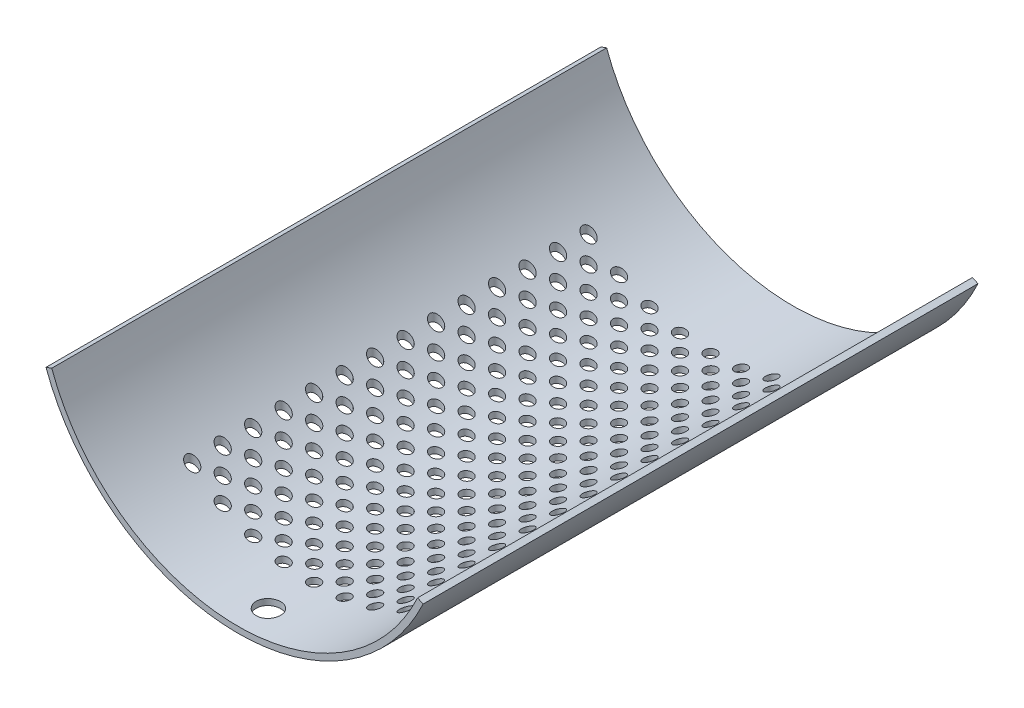
from build123d import *

# Parameters (mm, degrees)
BOSS_EXTRUDE1_DEPTH      = 170
BOSS_EXTRUDE1_DEPTH_BACK = 12
SKETCH2_R                = 2
SKETCH2_R_2              = 4
CUT_EXTRUDE1_DEPTH       = 90


with BuildPart() as part:
    # Sketch1 → Boss-Extrude1 (new, two sides: drawn at the far end of the back side and taken through both)
    with BuildSketch(Plane.XY.offset(-BOSS_EXTRUDE1_DEPTH_BACK)):
        with BuildLine():
            Line((-61.080020351, -22.231309316), (-62.959405593, -22.915349603))
            ThreePointArc((-62.959405593, -22.915349603), (-2.922498953, -66.936230846), (60.722621731, -28.315423537))
            Line((60.722621731, -28.315423537), (58.910006157, -27.470187013))
            ThreePointArc((58.910006157, -27.470187013), (-2.835260179, -64.938134403), (-61.080020351, -22.231309316))
        make_face()
    extrude(amount=BOSS_EXTRUDE1_DEPTH + BOSS_EXTRUDE1_DEPTH_BACK)

    # Sketch2 → Cut-Extrude1 (cut)
    with BuildSketch(Plane(origin=(0, 0, 0), x_dir=(1, 0, 0), z_dir=(0, 1, 0))):
        with Locations(Location((0, -145, 0), (0, 0, 270))):
            Circle(SKETCH2_R)
        with Locations(Location((10, -145, 0), (0, 0, 270))):
            Circle(SKETCH2_R)
        with Locations(Location((20, -145, 0), (0, 0, 270))):
            Circle(SKETCH2_R)
        with Locations(Location((30, -145, 0), (0, 0, 270))):
            Circle(SKETCH2_R)
        with Locations(Location((40, -145, 0), (0, 0, 270))):
            Circle(SKETCH2_R)
        with Locations(Location((10, -135, 0), (0, 0, 270))):
            Circle(SKETCH2_R)
        with Locations(Location((20, -135, 0), (0, 0, 270))):
            Circle(SKETCH2_R)
        with Locations(Location((30, -135, 0), (0, 0, 270))):
            Circle(SKETCH2_R)
        with Locations(Location((40, -135, 0), (0, 0, 270))):
            Circle(SKETCH2_R)
        with Locations(Location((10, -125, 0), (0, 0, 270))):
            Circle(SKETCH2_R)
        with Locations(Location((20, -125, 0), (0, 0, 270))):
            Circle(SKETCH2_R)
        with Locations(Location((30, -125, 0), (0, 0, 270))):
            Circle(SKETCH2_R)
        with Locations(Location((40, -125, 0), (0, 0, 270))):
            Circle(SKETCH2_R)
        with Locations(Location((10, -115, 0), (0, 0, 270))):
            Circle(SKETCH2_R)
        with Locations(Location((20, -115, 0), (0, 0, 270))):
            Circle(SKETCH2_R)
        with Locations(Location((30, -115, 0), (0, 0, 270))):
            Circle(SKETCH2_R)
        with Locations(Location((40, -115, 0), (0, 0, 270))):
            Circle(SKETCH2_R)
        with Locations(Location((10, -105, 0), (0, 0, 270))):
            Circle(SKETCH2_R)
        with Locations(Location((20, -105, 0), (0, 0, 270))):
            Circle(SKETCH2_R)
        with Locations(Location((30, -105, 0), (0, 0, 270))):
            Circle(SKETCH2_R)
        with Locations(Location((40, -105, 0), (0, 0, 270))):
            Circle(SKETCH2_R)
        with Locations(Location((10, -95, 0), (0, 0, 270))):
            Circle(SKETCH2_R)
        with Locations(Location((20, -95, 0), (0, 0, 270))):
            Circle(SKETCH2_R)
        with Locations(Location((30, -95, 0), (0, 0, 270))):
            Circle(SKETCH2_R)
        with Locations(Location((40, -95, 0), (0, 0, 270))):
            Circle(SKETCH2_R)
        with Locations(Location((10, -85, 0), (0, 0, 270))):
            Circle(SKETCH2_R)
        with Locations(Location((20, -85, 0), (0, 0, 270))):
            Circle(SKETCH2_R)
        with Locations(Location((30, -85, 0), (0, 0, 270))):
            Circle(SKETCH2_R)
        with Locations(Location((40, -85, 0), (0, 0, 270))):
            Circle(SKETCH2_R)
        with Locations(Location((10, -75, 0), (0, 0, 270))):
            Circle(SKETCH2_R)
        with Locations(Location((20, -75, 0), (0, 0, 270))):
            Circle(SKETCH2_R)
        with Locations(Location((30, -75, 0), (0, 0, 270))):
            Circle(SKETCH2_R)
        with Locations(Location((40, -75, 0), (0, 0, 270))):
            Circle(SKETCH2_R)
        with Locations(Location((10, -65, 0), (0, 0, 270))):
            Circle(SKETCH2_R)
        with Locations(Location((20, -65, 0), (0, 0, 270))):
            Circle(SKETCH2_R)
        with Locations(Location((30, -65, 0), (0, 0, 270))):
            Circle(SKETCH2_R)
        with Locations(Location((40, -65, 0), (0, 0, 270))):
            Circle(SKETCH2_R)
        with Locations(Location((10, -55, 0), (0, 0, 270))):
            Circle(SKETCH2_R)
        with Locations(Location((20, -55, 0), (0, 0, 270))):
            Circle(SKETCH2_R)
        with Locations(Location((30, -55, 0), (0, 0, 270))):
            Circle(SKETCH2_R)
        with Locations(Location((40, -55, 0), (0, 0, 270))):
            Circle(SKETCH2_R)
        with Locations(Location((10, -45, 0), (0, 0, 270))):
            Circle(SKETCH2_R)
        with Locations(Location((20, -45, 0), (0, 0, 270))):
            Circle(SKETCH2_R)
        with Locations(Location((30, -45, 0), (0, 0, 270))):
            Circle(SKETCH2_R)
        with Locations(Location((40, -45, 0), (0, 0, 270))):
            Circle(SKETCH2_R)
        with Locations(Location((10, -35, 0), (0, 0, 270))):
            Circle(SKETCH2_R)
        with Locations(Location((20, -35, 0), (0, 0, 270))):
            Circle(SKETCH2_R)
        with Locations(Location((30, -35, 0), (0, 0, 270))):
            Circle(SKETCH2_R)
        with Locations(Location((40, -35, 0), (0, 0, 270))):
            Circle(SKETCH2_R)
        with Locations(Location((10, -25, 0), (0, 0, 270))):
            Circle(SKETCH2_R)
        with Locations(Location((20, -25, 0), (0, 0, 270))):
            Circle(SKETCH2_R)
        with Locations(Location((30, -25, 0), (0, 0, 270))):
            Circle(SKETCH2_R)
        with Locations(Location((40, -25, 0), (0, 0, 270))):
            Circle(SKETCH2_R)
        with Locations(Location((10, -15, 0), (0, 0, 270))):
            Circle(SKETCH2_R)
        with Locations(Location((20, -15, 0), (0, 0, 270))):
            Circle(SKETCH2_R)
        with Locations(Location((30, -15, 0), (0, 0, 270))):
            Circle(SKETCH2_R)
        with Locations(Location((40, -15, 0), (0, 0, 270))):
            Circle(SKETCH2_R)
        with Locations(Location((0, -135, 0), (0, 0, 270))):
            Circle(SKETCH2_R)
        with Locations(Location((0, -125, 0), (0, 0, 270))):
            Circle(SKETCH2_R)
        with Locations(Location((0, -115, 0), (0, 0, 270))):
            Circle(SKETCH2_R)
        with Locations(Location((0, -105, 0), (0, 0, 270))):
            Circle(SKETCH2_R)
        with Locations(Location((0, -95, 0), (0, 0, 270))):
            Circle(SKETCH2_R)
        with Locations(Location((0, -85, 0), (0, 0, 270))):
            Circle(SKETCH2_R)
        with Locations(Location((0, -75, 0), (0, 0, 270))):
            Circle(SKETCH2_R)
        with Locations(Location((0, -65, 0), (0, 0, 270))):
            Circle(SKETCH2_R)
        with Locations(Location((0, -55, 0), (0, 0, 270))):
            Circle(SKETCH2_R)
        with Locations(Location((0, -45, 0), (0, 0, 270))):
            Circle(SKETCH2_R)
        with Locations(Location((0, -35, 0), (0, 0, 270))):
            Circle(SKETCH2_R)
        with Locations(Location((0, -25, 0), (0, 0, 270))):
            Circle(SKETCH2_R)
        with Locations(Location((0, -15, 0), (0, 0, 270))):
            Circle(SKETCH2_R)
        with Locations(Location((0, -160, 0), (0, 0, 270))):
            Circle(SKETCH2_R_2)
        with Locations(Location((-10, -145, 0), (0, 0, 270))):
            Circle(SKETCH2_R)
        with Locations(Location((-20, -145, 0), (0, 0, 270))):
            Circle(SKETCH2_R)
        with Locations(Location((-30, -145, 0), (0, 0, 270))):
            Circle(SKETCH2_R)
        with Locations(Location((-40, -145, 0), (0, 0, 270))):
            Circle(SKETCH2_R)
        with Locations(Location((-10, -135, 0), (0, 0, 270))):
            Circle(SKETCH2_R)
        with Locations(Location((-20, -135, 0), (0, 0, 270))):
            Circle(SKETCH2_R)
        with Locations(Location((-30, -135, 0), (0, 0, 270))):
            Circle(SKETCH2_R)
        with Locations(Location((-40, -135, 0), (0, 0, 270))):
            Circle(SKETCH2_R)
        with Locations(Location((-10, -125, 0), (0, 0, 270))):
            Circle(SKETCH2_R)
        with Locations(Location((-20, -125, 0), (0, 0, 270))):
            Circle(SKETCH2_R)
        with Locations(Location((-30, -125, 0), (0, 0, 270))):
            Circle(SKETCH2_R)
        with Locations(Location((-40, -125, 0), (0, 0, 270))):
            Circle(SKETCH2_R)
        with Locations(Location((-10, -115, 0), (0, 0, 270))):
            Circle(SKETCH2_R)
        with Locations(Location((-20, -115, 0), (0, 0, 270))):
            Circle(SKETCH2_R)
        with Locations(Location((-30, -115, 0), (0, 0, 270))):
            Circle(SKETCH2_R)
        with Locations(Location((-40, -115, 0), (0, 0, 270))):
            Circle(SKETCH2_R)
        with Locations(Location((-10, -105, 0), (0, 0, 270))):
            Circle(SKETCH2_R)
        with Locations(Location((-20, -105, 0), (0, 0, 270))):
            Circle(SKETCH2_R)
        with Locations(Location((-30, -105, 0), (0, 0, 270))):
            Circle(SKETCH2_R)
        with Locations(Location((-40, -105, 0), (0, 0, 270))):
            Circle(SKETCH2_R)
        with Locations(Location((-10, -95, 0), (0, 0, 270))):
            Circle(SKETCH2_R)
        with Locations(Location((-20, -95, 0), (0, 0, 270))):
            Circle(SKETCH2_R)
        with Locations(Location((-30, -95, 0), (0, 0, 270))):
            Circle(SKETCH2_R)
        with Locations(Location((-40, -95, 0), (0, 0, 270))):
            Circle(SKETCH2_R)
        with Locations(Location((-10, -85, 0), (0, 0, 270))):
            Circle(SKETCH2_R)
        with Locations(Location((-20, -85, 0), (0, 0, 270))):
            Circle(SKETCH2_R)
        with Locations(Location((-30, -85, 0), (0, 0, 270))):
            Circle(SKETCH2_R)
        with Locations(Location((-40, -85, 0), (0, 0, 270))):
            Circle(SKETCH2_R)
        with Locations(Location((-10, -75, 0), (0, 0, 270))):
            Circle(SKETCH2_R)
        with Locations(Location((-20, -75, 0), (0, 0, 270))):
            Circle(SKETCH2_R)
        with Locations(Location((-30, -75, 0), (0, 0, 270))):
            Circle(SKETCH2_R)
        with Locations(Location((-40, -75, 0), (0, 0, 270))):
            Circle(SKETCH2_R)
        with Locations(Location((-10, -65, 0), (0, 0, 270))):
            Circle(SKETCH2_R)
        with Locations(Location((-20, -65, 0), (0, 0, 270))):
            Circle(SKETCH2_R)
        with Locations(Location((-30, -65, 0), (0, 0, 270))):
            Circle(SKETCH2_R)
        with Locations(Location((-40, -65, 0), (0, 0, 270))):
            Circle(SKETCH2_R)
        with Locations(Location((-10, -55, 0), (0, 0, 270))):
            Circle(SKETCH2_R)
        with Locations(Location((-20, -55, 0), (0, 0, 270))):
            Circle(SKETCH2_R)
        with Locations(Location((-30, -55, 0), (0, 0, 270))):
            Circle(SKETCH2_R)
        with Locations(Location((-40, -55, 0), (0, 0, 270))):
            Circle(SKETCH2_R)
        with Locations(Location((-10, -45, 0), (0, 0, 270))):
            Circle(SKETCH2_R)
        with Locations(Location((-20, -45, 0), (0, 0, 270))):
            Circle(SKETCH2_R)
        with Locations(Location((-30, -45, 0), (0, 0, 270))):
            Circle(SKETCH2_R)
        with Locations(Location((-40, -45, 0), (0, 0, 270))):
            Circle(SKETCH2_R)
        with Locations(Location((-10, -35, 0), (0, 0, 270))):
            Circle(SKETCH2_R)
        with Locations(Location((-20, -35, 0), (0, 0, 270))):
            Circle(SKETCH2_R)
        with Locations(Location((-30, -35, 0), (0, 0, 270))):
            Circle(SKETCH2_R)
        with Locations(Location((-40, -35, 0), (0, 0, 270))):
            Circle(SKETCH2_R)
        with Locations(Location((-10, -25, 0), (0, 0, 270))):
            Circle(SKETCH2_R)
        with Locations(Location((-20, -25, 0), (0, 0, 270))):
            Circle(SKETCH2_R)
        with Locations(Location((-30, -25, 0), (0, 0, 270))):
            Circle(SKETCH2_R)
        with Locations(Location((-40, -25, 0), (0, 0, 270))):
            Circle(SKETCH2_R)
        with Locations(Location((-10, -15, 0), (0, 0, 270))):
            Circle(SKETCH2_R)
        with Locations(Location((-20, -15, 0), (0, 0, 270))):
            Circle(SKETCH2_R)
        with Locations(Location((-30, -15, 0), (0, 0, 270))):
            Circle(SKETCH2_R)
        with Locations(Location((-40, -15, 0), (0, 0, 270))):
            Circle(SKETCH2_R)
        with Locations(Location((35, -140, 0), (0, 0, 270))):
            Circle(SKETCH2_R)
        with Locations(Location((25, -140, 0), (0, 0, 270))):
            Circle(SKETCH2_R)
        with Locations(Location((15, -140, 0), (0, 0, 270))):
            Circle(SKETCH2_R)
        with Locations(Location((5, -140, 0), (0, 0, 270))):
            Circle(SKETCH2_R)
        with Locations(Location((-5, -140, 0), (0, 0, 270))):
            Circle(SKETCH2_R)
        with Locations(Location((-15, -140, 0), (0, 0, 270))):
            Circle(SKETCH2_R)
        with Locations(Location((-25, -140, 0), (0, 0, 270))):
            Circle(SKETCH2_R)
        with Locations(Location((-35, -140, 0), (0, 0, 270))):
            Circle(SKETCH2_R)
        with Locations(Location((25, -130, 0), (0, 0, 270))):
            Circle(SKETCH2_R)
        with Locations(Location((15, -130, 0), (0, 0, 270))):
            Circle(SKETCH2_R)
        with Locations(Location((5, -130, 0), (0, 0, 270))):
            Circle(SKETCH2_R)
        with Locations(Location((-5, -130, 0), (0, 0, 270))):
            Circle(SKETCH2_R)
        with Locations(Location((-15, -130, 0), (0, 0, 270))):
            Circle(SKETCH2_R)
        with Locations(Location((-25, -130, 0), (0, 0, 270))):
            Circle(SKETCH2_R)
        with Locations(Location((-35, -130, 0), (0, 0, 270))):
            Circle(SKETCH2_R)
        with Locations(Location((25, -120, 0), (0, 0, 270))):
            Circle(SKETCH2_R)
        with Locations(Location((15, -120, 0), (0, 0, 270))):
            Circle(SKETCH2_R)
        with Locations(Location((5, -120, 0), (0, 0, 270))):
            Circle(SKETCH2_R)
        with Locations(Location((-5, -120, 0), (0, 0, 270))):
            Circle(SKETCH2_R)
        with Locations(Location((-15, -120, 0), (0, 0, 270))):
            Circle(SKETCH2_R)
        with Locations(Location((-25, -120, 0), (0, 0, 270))):
            Circle(SKETCH2_R)
        with Locations(Location((-35, -120, 0), (0, 0, 270))):
            Circle(SKETCH2_R)
        with Locations(Location((25, -110, 0), (0, 0, 270))):
            Circle(SKETCH2_R)
        with Locations(Location((15, -110, 0), (0, 0, 270))):
            Circle(SKETCH2_R)
        with Locations(Location((5, -110, 0), (0, 0, 270))):
            Circle(SKETCH2_R)
        with Locations(Location((-5, -110, 0), (0, 0, 270))):
            Circle(SKETCH2_R)
        with Locations(Location((-15, -110, 0), (0, 0, 270))):
            Circle(SKETCH2_R)
        with Locations(Location((-25, -110, 0), (0, 0, 270))):
            Circle(SKETCH2_R)
        with Locations(Location((-35, -110, 0), (0, 0, 270))):
            Circle(SKETCH2_R)
        with Locations(Location((25, -100, 0), (0, 0, 270))):
            Circle(SKETCH2_R)
        with Locations(Location((15, -100, 0), (0, 0, 270))):
            Circle(SKETCH2_R)
        with Locations(Location((5, -100, 0), (0, 0, 270))):
            Circle(SKETCH2_R)
        with Locations(Location((-5, -100, 0), (0, 0, 270))):
            Circle(SKETCH2_R)
        with Locations(Location((-15, -100, 0), (0, 0, 270))):
            Circle(SKETCH2_R)
        with Locations(Location((-25, -100, 0), (0, 0, 270))):
            Circle(SKETCH2_R)
        with Locations(Location((-35, -100, 0), (0, 0, 270))):
            Circle(SKETCH2_R)
        with Locations(Location((25, -90, 0), (0, 0, 270))):
            Circle(SKETCH2_R)
        with Locations(Location((15, -90, 0), (0, 0, 270))):
            Circle(SKETCH2_R)
        with Locations(Location((5, -90, 0), (0, 0, 270))):
            Circle(SKETCH2_R)
        with Locations(Location((-5, -90, 0), (0, 0, 270))):
            Circle(SKETCH2_R)
        with Locations(Location((-15, -90, 0), (0, 0, 270))):
            Circle(SKETCH2_R)
        with Locations(Location((-25, -90, 0), (0, 0, 270))):
            Circle(SKETCH2_R)
        with Locations(Location((-35, -90, 0), (0, 0, 270))):
            Circle(SKETCH2_R)
        with Locations(Location((25, -80, 0), (0, 0, 270))):
            Circle(SKETCH2_R)
        with Locations(Location((15, -80, 0), (0, 0, 270))):
            Circle(SKETCH2_R)
        with Locations(Location((5, -80, 0), (0, 0, 270))):
            Circle(SKETCH2_R)
        with Locations(Location((-5, -80, 0), (0, 0, 270))):
            Circle(SKETCH2_R)
        with Locations(Location((-15, -80, 0), (0, 0, 270))):
            Circle(SKETCH2_R)
        with Locations(Location((-25, -80, 0), (0, 0, 270))):
            Circle(SKETCH2_R)
        with Locations(Location((-35, -80, 0), (0, 0, 270))):
            Circle(SKETCH2_R)
        with Locations(Location((25, -70, 0), (0, 0, 270))):
            Circle(SKETCH2_R)
        with Locations(Location((15, -70, 0), (0, 0, 270))):
            Circle(SKETCH2_R)
        with Locations(Location((5, -70, 0), (0, 0, 270))):
            Circle(SKETCH2_R)
        with Locations(Location((-5, -70, 0), (0, 0, 270))):
            Circle(SKETCH2_R)
        with Locations(Location((-15, -70, 0), (0, 0, 270))):
            Circle(SKETCH2_R)
        with Locations(Location((-25, -70, 0), (0, 0, 270))):
            Circle(SKETCH2_R)
        with Locations(Location((-35, -70, 0), (0, 0, 270))):
            Circle(SKETCH2_R)
        with Locations(Location((25, -60, 0), (0, 0, 270))):
            Circle(SKETCH2_R)
        with Locations(Location((15, -60, 0), (0, 0, 270))):
            Circle(SKETCH2_R)
        with Locations(Location((5, -60, 0), (0, 0, 270))):
            Circle(SKETCH2_R)
        with Locations(Location((-5, -60, 0), (0, 0, 270))):
            Circle(SKETCH2_R)
        with Locations(Location((-15, -60, 0), (0, 0, 270))):
            Circle(SKETCH2_R)
        with Locations(Location((-25, -60, 0), (0, 0, 270))):
            Circle(SKETCH2_R)
        with Locations(Location((-35, -60, 0), (0, 0, 270))):
            Circle(SKETCH2_R)
        with Locations(Location((25, -50, 0), (0, 0, 270))):
            Circle(SKETCH2_R)
        with Locations(Location((15, -50, 0), (0, 0, 270))):
            Circle(SKETCH2_R)
        with Locations(Location((5, -50, 0), (0, 0, 270))):
            Circle(SKETCH2_R)
        with Locations(Location((-5, -50, 0), (0, 0, 270))):
            Circle(SKETCH2_R)
        with Locations(Location((-15, -50, 0), (0, 0, 270))):
            Circle(SKETCH2_R)
        with Locations(Location((-25, -50, 0), (0, 0, 270))):
            Circle(SKETCH2_R)
        with Locations(Location((-35, -50, 0), (0, 0, 270))):
            Circle(SKETCH2_R)
        with Locations(Location((25, -40, 0), (0, 0, 270))):
            Circle(SKETCH2_R)
        with Locations(Location((15, -40, 0), (0, 0, 270))):
            Circle(SKETCH2_R)
        with Locations(Location((5, -40, 0), (0, 0, 270))):
            Circle(SKETCH2_R)
        with Locations(Location((-5, -40, 0), (0, 0, 270))):
            Circle(SKETCH2_R)
        with Locations(Location((-15, -40, 0), (0, 0, 270))):
            Circle(SKETCH2_R)
        with Locations(Location((-25, -40, 0), (0, 0, 270))):
            Circle(SKETCH2_R)
        with Locations(Location((-35, -40, 0), (0, 0, 270))):
            Circle(SKETCH2_R)
        with Locations(Location((25, -30, 0), (0, 0, 270))):
            Circle(SKETCH2_R)
        with Locations(Location((15, -30, 0), (0, 0, 270))):
            Circle(SKETCH2_R)
        with Locations(Location((5, -30, 0), (0, 0, 270))):
            Circle(SKETCH2_R)
        with Locations(Location((-5, -30, 0), (0, 0, 270))):
            Circle(SKETCH2_R)
        with Locations(Location((-15, -30, 0), (0, 0, 270))):
            Circle(SKETCH2_R)
        with Locations(Location((-25, -30, 0), (0, 0, 270))):
            Circle(SKETCH2_R)
        with Locations(Location((-35, -30, 0), (0, 0, 270))):
            Circle(SKETCH2_R)
        with Locations(Location((25, -20, 0), (0, 0, 270))):
            Circle(SKETCH2_R)
        with Locations(Location((15, -20, 0), (0, 0, 270))):
            Circle(SKETCH2_R)
        with Locations(Location((5, -20, 0), (0, 0, 270))):
            Circle(SKETCH2_R)
        with Locations(Location((-5, -20, 0), (0, 0, 270))):
            Circle(SKETCH2_R)
        with Locations(Location((-15, -20, 0), (0, 0, 270))):
            Circle(SKETCH2_R)
        with Locations(Location((-25, -20, 0), (0, 0, 270))):
            Circle(SKETCH2_R)
        with Locations(Location((-35, -20, 0), (0, 0, 270))):
            Circle(SKETCH2_R)
        with Locations(Location((35, -130, 0), (0, 0, 270))):
            Circle(SKETCH2_R)
        with Locations(Location((35, -120, 0), (0, 0, 270))):
            Circle(SKETCH2_R)
        with Locations(Location((35, -110, 0), (0, 0, 270))):
            Circle(SKETCH2_R)
        with Locations(Location((35, -100, 0), (0, 0, 270))):
            Circle(SKETCH2_R)
        with Locations(Location((35, -90, 0), (0, 0, 270))):
            Circle(SKETCH2_R)
        with Locations(Location((35, -80, 0), (0, 0, 270))):
            Circle(SKETCH2_R)
        with Locations(Location((35, -70, 0), (0, 0, 270))):
            Circle(SKETCH2_R)
        with Locations(Location((35, -60, 0), (0, 0, 270))):
            Circle(SKETCH2_R)
        with Locations(Location((35, -50, 0), (0, 0, 270))):
            Circle(SKETCH2_R)
        with Locations(Location((35, -40, 0), (0, 0, 270))):
            Circle(SKETCH2_R)
        with Locations(Location((35, -30, 0), (0, 0, 270))):
            Circle(SKETCH2_R)
        with Locations(Location((35, -20, 0), (0, 0, 270))):
            Circle(SKETCH2_R)
    extrude(amount=-CUT_EXTRUDE1_DEPTH, mode=Mode.SUBTRACT)


solid = part.part
